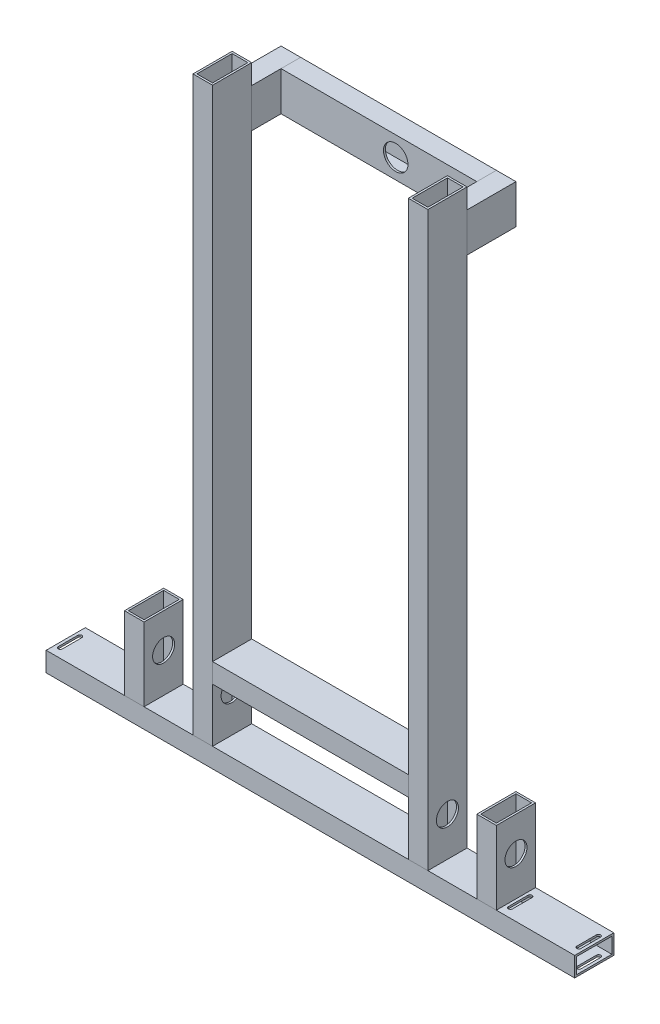
from build123d import *

# Parameters (mm, degrees)
VERSAFRAME_START                             = -152.4
VERSAFRAME_VERSAFRAME_2_X_1_X_0_1_1_OUT_W    = 742.95
VERSAFRAME_VERSAFRAME_2_X_1_X_0_1_1_OUT_H    = 50.8
VERSAFRAME_VERSAFRAME_2_X_1_X_0_1_1_DEPTH    = 2.54
VERSAFRAME_START_2                           = -129.54
VERSAFRAME_VERSAFRAME_2_X_1_X_0_1_1_2_O_W    = 742.95
VERSAFRAME_VERSAFRAME_2_X_1_X_0_1_1_2_O_H    = 50.8
VERSAFRAME_VERSAFRAME_2_X_1_X_0_1_1_2_DEPTH  = 2.54
VERSAFRAME_START_3                           = -149.86
VERSAFRAME_VERSAFRAME_2_X_1_X_0_1_1_3_O_W    = 742.95
VERSAFRAME_VERSAFRAME_2_X_1_X_0_1_1_3_O_H    = 2.54
VERSAFRAME_VERSAFRAME_2_X_1_X_0_1_1_3_DEPTH  = 20.32
VERSAFRAME_START_4                           = 127
VERSAFRAME_VERSAFRAME_2_X_1_X_0_1_1_4_O_W    = 742.95
VERSAFRAME_VERSAFRAME_2_X_1_X_0_1_1_4_O_H    = 50.8
VERSAFRAME_VERSAFRAME_2_X_1_X_0_1_1_4_DEPTH  = 2.54
VERSAFRAME_START_5                           = 149.86
VERSAFRAME_VERSAFRAME_2_X_1_X_0_1_1_5_O_W    = 742.95
VERSAFRAME_VERSAFRAME_2_X_1_X_0_1_1_5_O_H    = 50.8
VERSAFRAME_VERSAFRAME_2_X_1_X_0_1_1_5_DEPTH  = 2.54
VERSAFRAME_START_6                           = 129.54
VERSAFRAME_VERSAFRAME_2_X_1_X_0_1_1_6_O_W    = 742.95
VERSAFRAME_VERSAFRAME_2_X_1_X_0_1_1_6_O_H    = 2.54
VERSAFRAME_VERSAFRAME_2_X_1_X_0_1_1_6_DEPTH  = 20.32
VERSAFRAME_START_7                           = 69.85
VERSAFRAME_VERSAFRAME_2_X_1_X_0_1_1_7_O_W    = 254
VERSAFRAME_VERSAFRAME_2_X_1_X_0_1_1_7_O_H    = 50.8
VERSAFRAME_VERSAFRAME_2_X_1_X_0_1_1_7_DEPTH  = 2.54
VERSAFRAME_START_8                           = 92.71
VERSAFRAME_VERSAFRAME_2_X_1_X_0_1_1_8_O_W    = 254
VERSAFRAME_VERSAFRAME_2_X_1_X_0_1_1_8_O_H    = 50.8
VERSAFRAME_VERSAFRAME_2_X_1_X_0_1_1_8_DEPTH  = 2.54
VERSAFRAME_START_9                           = 72.39
VERSAFRAME_VERSAFRAME_2_X_1_X_0_1_1_9_O_W    = 254
VERSAFRAME_VERSAFRAME_2_X_1_X_0_1_1_9_O_H    = 2.54
VERSAFRAME_VERSAFRAME_2_X_1_X_0_1_1_9_DEPTH  = 20.32
VERSAFRAME_START_10                          = -25.4
VERSAFRAME_VERSAFRAME_2_X_1_X_0_1_1_11_W     = 685.8
VERSAFRAME_VERSAFRAME_2_X_1_X_0_1_1_11_H     = 50.8
VERSAFRAME_VERSAFRAME_2_X_1_X_0_1_1_10_DEPTH = 2.54
VERSAFRAME_START_11                          = -2.54
VERSAFRAME_VERSAFRAME_2_X_1_X_0_1_1_13_W     = 685.8
VERSAFRAME_VERSAFRAME_2_X_1_X_0_1_1_13_H     = 50.8
VERSAFRAME_VERSAFRAME_2_X_1_X_0_1_1_12_DEPTH = 2.54
VERSAFRAME_START_12                          = -22.86
VERSAFRAME_VERSAFRAME_2_X_1_X_0_1_1_15_W     = 685.8
VERSAFRAME_VERSAFRAME_2_X_1_X_0_1_1_15_H     = 2.54
VERSAFRAME_VERSAFRAME_2_X_1_X_0_1_1_14_DEPTH = 20.32
VERSAFRAME_START_13                          = -88.9
VERSAFRAME_VERSAFRAME_2_X_1_X_0_1_7_OUT_W    = 254
VERSAFRAME_VERSAFRAME_2_X_1_X_0_1_7_OUT_H    = 50.8
VERSAFRAME_VERSAFRAME_2_X_1_X_0_1_7_DEPTH    = 2.54
VERSAFRAME_START_14                          = -66.04
VERSAFRAME_VERSAFRAME_2_X_1_X_0_1_7_2_O_W    = 254
VERSAFRAME_VERSAFRAME_2_X_1_X_0_1_7_2_O_H    = 50.8
VERSAFRAME_VERSAFRAME_2_X_1_X_0_1_7_2_DEPTH  = 2.54
VERSAFRAME_START_15                          = -86.36
VERSAFRAME_VERSAFRAME_2_X_1_X_0_1_7_3_O_W    = 254
VERSAFRAME_VERSAFRAME_2_X_1_X_0_1_7_3_O_H    = 2.54
VERSAFRAME_VERSAFRAME_2_X_1_X_0_1_7_3_DEPTH  = 20.32
VERSAFRAME_VERSAFRAME_2_X_1_X_0_1_7_4_O_W    = 50.8
VERSAFRAME_VERSAFRAME_2_X_1_X_0_1_7_4_O_H    = 88.9
VERSAFRAME_VERSAFRAME_2_X_1_X_0_1_7_4_DEPTH  = 2.54
VERSAFRAME_VERSAFRAME_2_X_1_X_0_1_7_5_O_W    = 50.8
VERSAFRAME_VERSAFRAME_2_X_1_X_0_1_7_5_O_H    = 88.9
VERSAFRAME_VERSAFRAME_2_X_1_X_0_1_7_5_DEPTH  = 2.54
VERSAFRAME_VERSAFRAME_2_X_1_X_0_1_7_6_O_W    = 2.54
VERSAFRAME_VERSAFRAME_2_X_1_X_0_1_7_6_O_H    = 88.9
VERSAFRAME_VERSAFRAME_2_X_1_X_0_1_7_6_DEPTH  = 20.32
VERSAFRAME_VERSAFRAME_2_X_1_X_0_1_7_7_O_W    = 50.8
VERSAFRAME_VERSAFRAME_2_X_1_X_0_1_7_7_O_H    = 88.9
VERSAFRAME_VERSAFRAME_2_X_1_X_0_1_7_7_DEPTH  = 2.54
VERSAFRAME_VERSAFRAME_2_X_1_X_0_1_7_8_O_W    = 50.8
VERSAFRAME_VERSAFRAME_2_X_1_X_0_1_7_8_O_H    = 88.9
VERSAFRAME_VERSAFRAME_2_X_1_X_0_1_7_8_DEPTH  = 2.54
VERSAFRAME_VERSAFRAME_2_X_1_X_0_1_7_9_O_W    = 2.54
VERSAFRAME_VERSAFRAME_2_X_1_X_0_1_7_9_O_H    = 88.9
VERSAFRAME_VERSAFRAME_2_X_1_X_0_1_7_9_DEPTH  = 20.32
VERSAFRAME_START_16                          = 215.9
VERSAFRAME_VERSAFRAME_2_X_1_X_0_1_8_OUT_W    = 95.25
VERSAFRAME_VERSAFRAME_2_X_1_X_0_1_8_OUT_H    = 50.8
VERSAFRAME_VERSAFRAME_2_X_1_X_0_1_8_DEPTH    = 2.54
VERSAFRAME_START_17                          = 238.76
VERSAFRAME_VERSAFRAME_2_X_1_X_0_1_8_2_O_W    = 95.25
VERSAFRAME_VERSAFRAME_2_X_1_X_0_1_8_2_O_H    = 50.8
VERSAFRAME_VERSAFRAME_2_X_1_X_0_1_8_2_DEPTH  = 2.54
VERSAFRAME_START_18                          = 218.44
VERSAFRAME_VERSAFRAME_2_X_1_X_0_1_8_3_O_W    = 95.25
VERSAFRAME_VERSAFRAME_2_X_1_X_0_1_8_3_O_H    = 2.54
VERSAFRAME_VERSAFRAME_2_X_1_X_0_1_8_3_DEPTH  = 20.32
VERSAFRAME_START_19                          = -241.3
VERSAFRAME_VERSAFRAME_2_X_1_X_0_1_8_4_O_W    = 95.25
VERSAFRAME_VERSAFRAME_2_X_1_X_0_1_8_4_O_H    = 50.8
VERSAFRAME_VERSAFRAME_2_X_1_X_0_1_8_4_DEPTH  = 2.54
VERSAFRAME_START_20                          = -218.44
VERSAFRAME_VERSAFRAME_2_X_1_X_0_1_8_5_O_W    = 95.25
VERSAFRAME_VERSAFRAME_2_X_1_X_0_1_8_5_O_H    = 50.8
VERSAFRAME_VERSAFRAME_2_X_1_X_0_1_8_5_DEPTH  = 2.54
VERSAFRAME_START_21                          = -238.76
VERSAFRAME_VERSAFRAME_2_X_1_X_0_1_8_6_O_W    = 95.25
VERSAFRAME_VERSAFRAME_2_X_1_X_0_1_8_6_O_H    = 2.54
VERSAFRAME_VERSAFRAME_2_X_1_X_0_1_8_6_DEPTH  = 20.32
CUT_EXTRUDE1_DEPTH                           = 824.07856399
CUT_EXTRUDE1_DEPTH_BACK                      = 824.07856399
SKETCH2_R                                    = 14.2875
CUT_EXTRUDE4_DEPTH                           = 824.07856399
CUT_EXTRUDE4_DEPTH_BACK                      = 824.07856399
SKETCH2_2_R                                  = 14.2875
CUT_EXTRUDE5_START                           = -63.5
SKETCH17_R                                   = 15.875
CUT_EXTRUDE5_DEPTH                           = 25.4
CUT_EXTRUDE6_REACH                           = 825.079


# Read off the part's stored shape, not the designer's step: Versaframe VERSAFRAME 2 X 1 X 0.1 (1), Versaframe VERSAFRAME 2 X 1 X 0.1 (7), Versaframe VERSAFRAME 2 X 1 X 0.1 (8)
with BuildPart() as part:
    # Versaframe VERSAFRAME 2 X 1 X 0.1 (1) out → Versaframe VERSAFRAME 2 X 1 X 0.1 (1) (new body)
    with BuildSketch(Plane.YZ.offset(VERSAFRAME_START)):
        with Locations((371.475, 0)):
            Rectangle(VERSAFRAME_VERSAFRAME_2_X_1_X_0_1_1_OUT_W, VERSAFRAME_VERSAFRAME_2_X_1_X_0_1_1_OUT_H)
    extrude(amount=VERSAFRAME_VERSAFRAME_2_X_1_X_0_1_1_DEPTH)

    # Versaframe VERSAFRAME 2 X 1 X 0.1 _1 2 o → Versaframe VERSAFRAME 2 X 1 X 0.1 _1 2 (add)
    with BuildSketch(Plane.YZ.offset(VERSAFRAME_START_2)):
        with Locations((371.475, 0)):
            Rectangle(VERSAFRAME_VERSAFRAME_2_X_1_X_0_1_1_2_O_W, VERSAFRAME_VERSAFRAME_2_X_1_X_0_1_1_2_O_H)
    extrude(amount=VERSAFRAME_VERSAFRAME_2_X_1_X_0_1_1_2_DEPTH)

    # Versaframe VERSAFRAME 2 X 1 X 0.1 _1 3 o → Versaframe VERSAFRAME 2 X 1 X 0.1 _1 3 (add)
    with BuildSketch(Plane.YZ.offset(VERSAFRAME_START_3)):
        with Locations((371.475, 24.13)):
            Rectangle(VERSAFRAME_VERSAFRAME_2_X_1_X_0_1_1_3_O_W, VERSAFRAME_VERSAFRAME_2_X_1_X_0_1_1_3_O_H)
        with Locations((371.475, -24.13)):
            Rectangle(VERSAFRAME_VERSAFRAME_2_X_1_X_0_1_1_3_O_W, VERSAFRAME_VERSAFRAME_2_X_1_X_0_1_1_3_O_H)
    extrude(amount=VERSAFRAME_VERSAFRAME_2_X_1_X_0_1_1_3_DEPTH)


with BuildPart() as body_2:
    # Versaframe VERSAFRAME 2 X 1 X 0.1 _1 4 o → Versaframe VERSAFRAME 2 X 1 X 0.1 _1 4 (new body)
    with BuildSketch(Plane.YZ.offset(VERSAFRAME_START_4)):
        with Locations((371.475, 0)):
            Rectangle(VERSAFRAME_VERSAFRAME_2_X_1_X_0_1_1_4_O_W, VERSAFRAME_VERSAFRAME_2_X_1_X_0_1_1_4_O_H)
    extrude(amount=VERSAFRAME_VERSAFRAME_2_X_1_X_0_1_1_4_DEPTH)

    # Versaframe VERSAFRAME 2 X 1 X 0.1 _1 5 o → Versaframe VERSAFRAME 2 X 1 X 0.1 _1 5 (add)
    with BuildSketch(Plane.YZ.offset(VERSAFRAME_START_5)):
        with Locations((371.475, 0)):
            Rectangle(VERSAFRAME_VERSAFRAME_2_X_1_X_0_1_1_5_O_W, VERSAFRAME_VERSAFRAME_2_X_1_X_0_1_1_5_O_H)
    extrude(amount=VERSAFRAME_VERSAFRAME_2_X_1_X_0_1_1_5_DEPTH)

    # Versaframe VERSAFRAME 2 X 1 X 0.1 _1 6 o → Versaframe VERSAFRAME 2 X 1 X 0.1 _1 6 (add)
    with BuildSketch(Plane.YZ.offset(VERSAFRAME_START_6)):
        with Locations((371.475, 24.13)):
            Rectangle(VERSAFRAME_VERSAFRAME_2_X_1_X_0_1_1_6_O_W, VERSAFRAME_VERSAFRAME_2_X_1_X_0_1_1_6_O_H)
        with Locations((371.475, -24.13)):
            Rectangle(VERSAFRAME_VERSAFRAME_2_X_1_X_0_1_1_6_O_W, VERSAFRAME_VERSAFRAME_2_X_1_X_0_1_1_6_O_H)
    extrude(amount=VERSAFRAME_VERSAFRAME_2_X_1_X_0_1_1_6_DEPTH)


with BuildPart() as body_3:
    # Versaframe VERSAFRAME 2 X 1 X 0.1 _1 7 o → Versaframe VERSAFRAME 2 X 1 X 0.1 _1 7 (new body)
    with BuildSketch(Plane(origin=(0, 0, 0), x_dir=(1, 0, 0), z_dir=(0, 1, 0)).offset(VERSAFRAME_START_7)):
        Rectangle(VERSAFRAME_VERSAFRAME_2_X_1_X_0_1_1_7_O_W, VERSAFRAME_VERSAFRAME_2_X_1_X_0_1_1_7_O_H)
    extrude(amount=VERSAFRAME_VERSAFRAME_2_X_1_X_0_1_1_7_DEPTH)

    # Versaframe VERSAFRAME 2 X 1 X 0.1 _1 8 o → Versaframe VERSAFRAME 2 X 1 X 0.1 _1 8 (add)
    with BuildSketch(Plane(origin=(0, 0, 0), x_dir=(1, 0, 0), z_dir=(0, 1, 0)).offset(VERSAFRAME_START_8)):
        Rectangle(VERSAFRAME_VERSAFRAME_2_X_1_X_0_1_1_8_O_W, VERSAFRAME_VERSAFRAME_2_X_1_X_0_1_1_8_O_H)
    extrude(amount=VERSAFRAME_VERSAFRAME_2_X_1_X_0_1_1_8_DEPTH)

    # Versaframe VERSAFRAME 2 X 1 X 0.1 _1 9 o → Versaframe VERSAFRAME 2 X 1 X 0.1 _1 9 (add)
    with BuildSketch(Plane(origin=(0, 0, 0), x_dir=(1, 0, 0), z_dir=(0, 1, 0)).offset(VERSAFRAME_START_9)):
        with Locations((0, 24.13)):
            Rectangle(VERSAFRAME_VERSAFRAME_2_X_1_X_0_1_1_9_O_W, VERSAFRAME_VERSAFRAME_2_X_1_X_0_1_1_9_O_H)
        with Locations((0, -24.13)):
            Rectangle(VERSAFRAME_VERSAFRAME_2_X_1_X_0_1_1_9_O_W, VERSAFRAME_VERSAFRAME_2_X_1_X_0_1_1_9_O_H)
    extrude(amount=VERSAFRAME_VERSAFRAME_2_X_1_X_0_1_1_9_DEPTH)


with BuildPart() as body_4:
    # Versaframe VERSAFRAME 2 X 1 X 0.1 _1 11 → Versaframe VERSAFRAME 2 X 1 X 0.1 _1 10 (new body)
    with BuildSketch(Plane(origin=(0, 0, 0), x_dir=(1, 0, 0), z_dir=(0, 1, 0)).offset(VERSAFRAME_START_10)):
        Rectangle(VERSAFRAME_VERSAFRAME_2_X_1_X_0_1_1_11_W, VERSAFRAME_VERSAFRAME_2_X_1_X_0_1_1_11_H)
    extrude(amount=VERSAFRAME_VERSAFRAME_2_X_1_X_0_1_1_10_DEPTH)

    # Versaframe VERSAFRAME 2 X 1 X 0.1 _1 13 → Versaframe VERSAFRAME 2 X 1 X 0.1 _1 12 (add)
    with BuildSketch(Plane(origin=(0, 0, 0), x_dir=(1, 0, 0), z_dir=(0, 1, 0)).offset(VERSAFRAME_START_11)):
        Rectangle(VERSAFRAME_VERSAFRAME_2_X_1_X_0_1_1_13_W, VERSAFRAME_VERSAFRAME_2_X_1_X_0_1_1_13_H)
    extrude(amount=VERSAFRAME_VERSAFRAME_2_X_1_X_0_1_1_12_DEPTH)

    # Versaframe VERSAFRAME 2 X 1 X 0.1 _1 15 → Versaframe VERSAFRAME 2 X 1 X 0.1 _1 14 (add)
    with BuildSketch(Plane(origin=(0, 0, 0), x_dir=(1, 0, 0), z_dir=(0, 1, 0)).offset(VERSAFRAME_START_12)):
        with Locations((0, -24.13)):
            Rectangle(VERSAFRAME_VERSAFRAME_2_X_1_X_0_1_1_15_W, VERSAFRAME_VERSAFRAME_2_X_1_X_0_1_1_15_H)
        with Locations((0, 24.13)):
            Rectangle(VERSAFRAME_VERSAFRAME_2_X_1_X_0_1_1_15_W, VERSAFRAME_VERSAFRAME_2_X_1_X_0_1_1_15_H)
    extrude(amount=VERSAFRAME_VERSAFRAME_2_X_1_X_0_1_1_14_DEPTH)

    # Cut-Extrude6: up to this face of the body (flat: up to its plane)
    cut_extrude6_end = Plane(body_4.part.faces().sort_by_distance((0, -25.4, 0))[0])
    # Sketch18 → Cut-Extrude6 (cut, up to the picked face)
    with BuildSketch(Plane(origin=(0, 0, 0), x_dir=(1, 0, 0), z_dir=(0, 1, 0)), mode=Mode.PRIVATE) as cut_extrude6_sk1:
        with BuildLine():
            Line((333.883, 11.938), (333.883, -13.462))
            ThreePointArc((333.883, -13.462), (336.55, -16.129), (339.217, -13.462))
            Line((339.217, -13.462), (339.217, 11.938))
            ThreePointArc((339.217, 11.938), (336.55, 14.605), (333.883, 11.938))
        make_face()
    cut_extrude6_tool1 = split(extrude(cut_extrude6_sk1.sketch, amount=-CUT_EXTRUDE6_REACH, mode=Mode.PRIVATE), bisect_by=cut_extrude6_end, keep=Keep.BOTH, mode=Mode.PRIVATE)
    # Sketch18 → Cut-Extrude6 (cut, up to the picked face)
    with BuildSketch(Plane(origin=(0, 0, 0), x_dir=(1, 0, 0), z_dir=(0, 1, 0)), mode=Mode.PRIVATE) as cut_extrude6_sk2:
        with BuildLine():
            Line((250.317, 11.938), (250.317, -13.462))
            ThreePointArc((250.317, -13.462), (247.65, -16.129), (244.983, -13.462))
            Line((244.983, -13.462), (244.983, 11.938))
            ThreePointArc((244.983, 11.938), (247.65, 14.605), (250.317, 11.938))
        make_face()
    cut_extrude6_tool2 = split(extrude(cut_extrude6_sk2.sketch, amount=-CUT_EXTRUDE6_REACH, mode=Mode.PRIVATE), bisect_by=cut_extrude6_end, keep=Keep.BOTH, mode=Mode.PRIVATE)
    # Sketch18 → Cut-Extrude6 (cut, up to the picked face)
    with BuildSketch(Plane(origin=(0, 0, 0), x_dir=(1, 0, 0), z_dir=(0, 1, 0)), mode=Mode.PRIVATE) as cut_extrude6_sk3:
        with BuildLine():
            Line((-339.217, 11.938), (-339.217, -13.462))
            ThreePointArc((-339.217, -13.462), (-336.55, -16.129), (-333.883, -13.462))
            Line((-333.883, -13.462), (-333.883, 11.938))
            ThreePointArc((-333.883, 11.938), (-336.55, 14.605), (-339.217, 11.938))
        make_face()
    cut_extrude6_tool3 = split(extrude(cut_extrude6_sk3.sketch, amount=-CUT_EXTRUDE6_REACH, mode=Mode.PRIVATE), bisect_by=cut_extrude6_end, keep=Keep.BOTH, mode=Mode.PRIVATE)
    # Sketch18 → Cut-Extrude6 (cut, up to the picked face)
    with BuildSketch(Plane(origin=(0, 0, 0), x_dir=(1, 0, 0), z_dir=(0, 1, 0)), mode=Mode.PRIVATE) as cut_extrude6_sk4:
        with BuildLine():
            Line((-244.983, 11.938), (-244.983, -13.462))
            ThreePointArc((-244.983, -13.462), (-247.65, -16.129), (-250.317, -13.462))
            Line((-250.317, -13.462), (-250.317, 11.938))
            ThreePointArc((-250.317, 11.938), (-247.65, 14.605), (-244.983, 11.938))
        make_face()
    cut_extrude6_tool4 = split(extrude(cut_extrude6_sk4.sketch, amount=-CUT_EXTRUDE6_REACH, mode=Mode.PRIVATE), bisect_by=cut_extrude6_end, keep=Keep.BOTH, mode=Mode.PRIVATE)
    add(cut_extrude6_tool1.solids().sort_by(Axis((336.55, 0, 0.762), (0, -1, 0)))[0], mode=Mode.SUBTRACT)
    add(cut_extrude6_tool2.solids().sort_by(Axis((247.65, 0, 0.762), (0, -1, 0)))[0], mode=Mode.SUBTRACT)
    add(cut_extrude6_tool3.solids().sort_by(Axis((-336.55, 0, 0.762), (0, -1, 0)))[0], mode=Mode.SUBTRACT)
    add(cut_extrude6_tool4.solids().sort_by(Axis((-247.65, 0, 0.762), (0, -1, 0)))[0], mode=Mode.SUBTRACT)


with BuildPart() as body_5:
    # Versaframe VERSAFRAME 2 X 1 X 0.1 (7) out → Versaframe VERSAFRAME 2 X 1 X 0.1 (7) (new body)
    with BuildSketch(Plane.XY.offset(VERSAFRAME_START_13)):
        with Locations((0, 691.754663298)):
            Rectangle(VERSAFRAME_VERSAFRAME_2_X_1_X_0_1_7_OUT_W, VERSAFRAME_VERSAFRAME_2_X_1_X_0_1_7_OUT_H)
    extrude(amount=VERSAFRAME_VERSAFRAME_2_X_1_X_0_1_7_DEPTH)

    # Versaframe VERSAFRAME 2 X 1 X 0.1 _7 2 o → Versaframe VERSAFRAME 2 X 1 X 0.1 _7 2 (add)
    with BuildSketch(Plane.XY.offset(VERSAFRAME_START_14)):
        with Locations((0, 691.754663298)):
            Rectangle(VERSAFRAME_VERSAFRAME_2_X_1_X_0_1_7_2_O_W, VERSAFRAME_VERSAFRAME_2_X_1_X_0_1_7_2_O_H)
    extrude(amount=VERSAFRAME_VERSAFRAME_2_X_1_X_0_1_7_2_DEPTH)

    # Versaframe VERSAFRAME 2 X 1 X 0.1 _7 3 o → Versaframe VERSAFRAME 2 X 1 X 0.1 _7 3 (add)
    with BuildSketch(Plane.XY.offset(VERSAFRAME_START_15)):
        with Locations((0, 667.624663298)):
            Rectangle(VERSAFRAME_VERSAFRAME_2_X_1_X_0_1_7_3_O_W, VERSAFRAME_VERSAFRAME_2_X_1_X_0_1_7_3_O_H)
        with Locations((0, 715.884663298)):
            Rectangle(VERSAFRAME_VERSAFRAME_2_X_1_X_0_1_7_3_O_W, VERSAFRAME_VERSAFRAME_2_X_1_X_0_1_7_3_O_H)
    extrude(amount=VERSAFRAME_VERSAFRAME_2_X_1_X_0_1_7_3_DEPTH)

    # Sketch17 → Cut-Extrude5 (cut)
    with BuildSketch(Plane.XY.offset(CUT_EXTRUDE5_START)):
        with Locations(Location((21.765, 691.754663298, 0), (0, 0, 90))):
            Circle(SKETCH17_R)
    extrude(amount=-CUT_EXTRUDE5_DEPTH, mode=Mode.SUBTRACT)


with BuildPart() as body_6:
    # Versaframe VERSAFRAME 2 X 1 X 0.1 _7 4 o → Versaframe VERSAFRAME 2 X 1 X 0.1 _7 4 (new body)
    with BuildSketch(Plane.YZ.offset(VERSAFRAME_START_4)):
        with Locations((691.754663298, -44.45)):
            Rectangle(VERSAFRAME_VERSAFRAME_2_X_1_X_0_1_7_4_O_W, VERSAFRAME_VERSAFRAME_2_X_1_X_0_1_7_4_O_H)
    extrude(amount=VERSAFRAME_VERSAFRAME_2_X_1_X_0_1_7_4_DEPTH)

    # Versaframe VERSAFRAME 2 X 1 X 0.1 _7 5 o → Versaframe VERSAFRAME 2 X 1 X 0.1 _7 5 (add)
    with BuildSketch(Plane.YZ.offset(VERSAFRAME_START_5)):
        with Locations((691.754663298, -44.45)):
            Rectangle(VERSAFRAME_VERSAFRAME_2_X_1_X_0_1_7_5_O_W, VERSAFRAME_VERSAFRAME_2_X_1_X_0_1_7_5_O_H)
    extrude(amount=VERSAFRAME_VERSAFRAME_2_X_1_X_0_1_7_5_DEPTH)

    # Versaframe VERSAFRAME 2 X 1 X 0.1 _7 6 o → Versaframe VERSAFRAME 2 X 1 X 0.1 _7 6 (add)
    with BuildSketch(Plane.YZ.offset(VERSAFRAME_START_6)):
        with Locations((667.624663298, -44.45)):
            Rectangle(VERSAFRAME_VERSAFRAME_2_X_1_X_0_1_7_6_O_W, VERSAFRAME_VERSAFRAME_2_X_1_X_0_1_7_6_O_H)
        with Locations((715.884663298, -44.45)):
            Rectangle(VERSAFRAME_VERSAFRAME_2_X_1_X_0_1_7_6_O_W, VERSAFRAME_VERSAFRAME_2_X_1_X_0_1_7_6_O_H)
    extrude(amount=VERSAFRAME_VERSAFRAME_2_X_1_X_0_1_7_6_DEPTH)

    # Trim_Extend3 11
    split(bisect_by=Plane(origin=(139.7, 371.475, -25.4), x_dir=(0, 1, 0), z_dir=(0, 0, -1)), keep=Keep.TOP)


with BuildPart() as body_7:
    # Versaframe VERSAFRAME 2 X 1 X 0.1 _7 7 o → Versaframe VERSAFRAME 2 X 1 X 0.1 _7 7 (new body)
    with BuildSketch(Plane.YZ.offset(VERSAFRAME_START)):
        with Locations((691.754663298, -44.45)):
            Rectangle(VERSAFRAME_VERSAFRAME_2_X_1_X_0_1_7_7_O_W, VERSAFRAME_VERSAFRAME_2_X_1_X_0_1_7_7_O_H)
    extrude(amount=VERSAFRAME_VERSAFRAME_2_X_1_X_0_1_7_7_DEPTH)

    # Versaframe VERSAFRAME 2 X 1 X 0.1 _7 8 o → Versaframe VERSAFRAME 2 X 1 X 0.1 _7 8 (add)
    with BuildSketch(Plane.YZ.offset(VERSAFRAME_START_2)):
        with Locations((691.754663298, -44.45)):
            Rectangle(VERSAFRAME_VERSAFRAME_2_X_1_X_0_1_7_8_O_W, VERSAFRAME_VERSAFRAME_2_X_1_X_0_1_7_8_O_H)
    extrude(amount=VERSAFRAME_VERSAFRAME_2_X_1_X_0_1_7_8_DEPTH)

    # Versaframe VERSAFRAME 2 X 1 X 0.1 _7 9 o → Versaframe VERSAFRAME 2 X 1 X 0.1 _7 9 (add)
    with BuildSketch(Plane.YZ.offset(VERSAFRAME_START_3)):
        with Locations((715.884663298, -44.45)):
            Rectangle(VERSAFRAME_VERSAFRAME_2_X_1_X_0_1_7_9_O_W, VERSAFRAME_VERSAFRAME_2_X_1_X_0_1_7_9_O_H)
        with Locations((667.624663298, -44.45)):
            Rectangle(VERSAFRAME_VERSAFRAME_2_X_1_X_0_1_7_9_O_W, VERSAFRAME_VERSAFRAME_2_X_1_X_0_1_7_9_O_H)
    extrude(amount=VERSAFRAME_VERSAFRAME_2_X_1_X_0_1_7_9_DEPTH)

    # Trim_Extend2 11
    split(bisect_by=Plane(origin=(-139.7, 371.475, -25.4), x_dir=(0, 1, 0), z_dir=(0, 0, -1)), keep=Keep.TOP)


with BuildPart() as body_8:
    # Versaframe VERSAFRAME 2 X 1 X 0.1 (8) out → Versaframe VERSAFRAME 2 X 1 X 0.1 (8) (new body)
    with BuildSketch(Plane.YZ.offset(VERSAFRAME_START_16)):
        with Locations((47.625, 0)):
            Rectangle(VERSAFRAME_VERSAFRAME_2_X_1_X_0_1_8_OUT_W, VERSAFRAME_VERSAFRAME_2_X_1_X_0_1_8_OUT_H)
    extrude(amount=VERSAFRAME_VERSAFRAME_2_X_1_X_0_1_8_DEPTH)

    # Versaframe VERSAFRAME 2 X 1 X 0.1 _8 2 o → Versaframe VERSAFRAME 2 X 1 X 0.1 _8 2 (add)
    with BuildSketch(Plane.YZ.offset(VERSAFRAME_START_17)):
        with Locations((47.625, 0)):
            Rectangle(VERSAFRAME_VERSAFRAME_2_X_1_X_0_1_8_2_O_W, VERSAFRAME_VERSAFRAME_2_X_1_X_0_1_8_2_O_H)
    extrude(amount=VERSAFRAME_VERSAFRAME_2_X_1_X_0_1_8_2_DEPTH)

    # Versaframe VERSAFRAME 2 X 1 X 0.1 _8 3 o → Versaframe VERSAFRAME 2 X 1 X 0.1 _8 3 (add)
    with BuildSketch(Plane.YZ.offset(VERSAFRAME_START_18)):
        with Locations((47.625, 24.13)):
            Rectangle(VERSAFRAME_VERSAFRAME_2_X_1_X_0_1_8_3_O_W, VERSAFRAME_VERSAFRAME_2_X_1_X_0_1_8_3_O_H)
        with Locations((47.625, -24.13)):
            Rectangle(VERSAFRAME_VERSAFRAME_2_X_1_X_0_1_8_3_O_W, VERSAFRAME_VERSAFRAME_2_X_1_X_0_1_8_3_O_H)
    extrude(amount=VERSAFRAME_VERSAFRAME_2_X_1_X_0_1_8_3_DEPTH)


with BuildPart() as body_9:
    # Versaframe VERSAFRAME 2 X 1 X 0.1 _8 4 o → Versaframe VERSAFRAME 2 X 1 X 0.1 _8 4 (new body)
    with BuildSketch(Plane.YZ.offset(VERSAFRAME_START_19)):
        with Locations((47.625, 0)):
            Rectangle(VERSAFRAME_VERSAFRAME_2_X_1_X_0_1_8_4_O_W, VERSAFRAME_VERSAFRAME_2_X_1_X_0_1_8_4_O_H)
    extrude(amount=VERSAFRAME_VERSAFRAME_2_X_1_X_0_1_8_4_DEPTH)

    # Versaframe VERSAFRAME 2 X 1 X 0.1 _8 5 o → Versaframe VERSAFRAME 2 X 1 X 0.1 _8 5 (add)
    with BuildSketch(Plane.YZ.offset(VERSAFRAME_START_20)):
        with Locations((47.625, 0)):
            Rectangle(VERSAFRAME_VERSAFRAME_2_X_1_X_0_1_8_5_O_W, VERSAFRAME_VERSAFRAME_2_X_1_X_0_1_8_5_O_H)
    extrude(amount=VERSAFRAME_VERSAFRAME_2_X_1_X_0_1_8_5_DEPTH)

    # Versaframe VERSAFRAME 2 X 1 X 0.1 _8 6 o → Versaframe VERSAFRAME 2 X 1 X 0.1 _8 6 (add)
    with BuildSketch(Plane.YZ.offset(VERSAFRAME_START_21)):
        with Locations((47.625, 24.13)):
            Rectangle(VERSAFRAME_VERSAFRAME_2_X_1_X_0_1_8_6_O_W, VERSAFRAME_VERSAFRAME_2_X_1_X_0_1_8_6_O_H)
        with Locations((47.625, -24.13)):
            Rectangle(VERSAFRAME_VERSAFRAME_2_X_1_X_0_1_8_6_O_W, VERSAFRAME_VERSAFRAME_2_X_1_X_0_1_8_6_O_H)
    extrude(amount=VERSAFRAME_VERSAFRAME_2_X_1_X_0_1_8_6_DEPTH)


with BuildPart() as cut_extrude1_tool:
    # Sketch2 → Cut-Extrude1 (new, two sides: drawn at the far end of the back side and taken through both)
    with BuildSketch(Plane(origin=(0, 0, 0), x_dir=(0, 0, -1), z_dir=(1, 0, 0)).offset(-CUT_EXTRUDE1_DEPTH_BACK)):
        with Locations((0, 50.8)):
            Circle(SKETCH2_R)
    extrude(amount=CUT_EXTRUDE1_DEPTH + CUT_EXTRUDE1_DEPTH_BACK)


with BuildPart() as part_1:
    add(part.part)

    # Cut-Extrude1: cut by cut_extrude1_tool
    add(cut_extrude1_tool.part, mode=Mode.SUBTRACT)


with BuildPart() as body_2_1:
    add(body_2.part)

    # Cut-Extrude1: cut by cut_extrude1_tool
    add(cut_extrude1_tool.part, mode=Mode.SUBTRACT)


with BuildPart() as cut_extrude4_tool:
    # Sketch2<2> → Cut-Extrude4 (new, two sides: drawn at the far end of the back side and taken through both)
    with BuildSketch(Plane(origin=(0, 0, 0), x_dir=(0, 0, -1), z_dir=(1, 0, 0)).offset(-CUT_EXTRUDE4_DEPTH_BACK)):
        with Locations((0, 50.8)):
            Circle(SKETCH2_2_R)
    extrude(amount=CUT_EXTRUDE4_DEPTH + CUT_EXTRUDE4_DEPTH_BACK)


with BuildPart() as body_8_1:
    add(body_8.part)

    # Cut-Extrude4: cut by cut_extrude4_tool
    add(cut_extrude4_tool.part, mode=Mode.SUBTRACT)


with BuildPart() as body_9_1:
    add(body_9.part)

    # Cut-Extrude4: cut by cut_extrude4_tool
    add(cut_extrude4_tool.part, mode=Mode.SUBTRACT)


solid = Compound([body_3.part, body_4.part, body_5.part, body_6.part, body_7.part, part_1.part, body_2_1.part, body_8_1.part, body_9_1.part])
